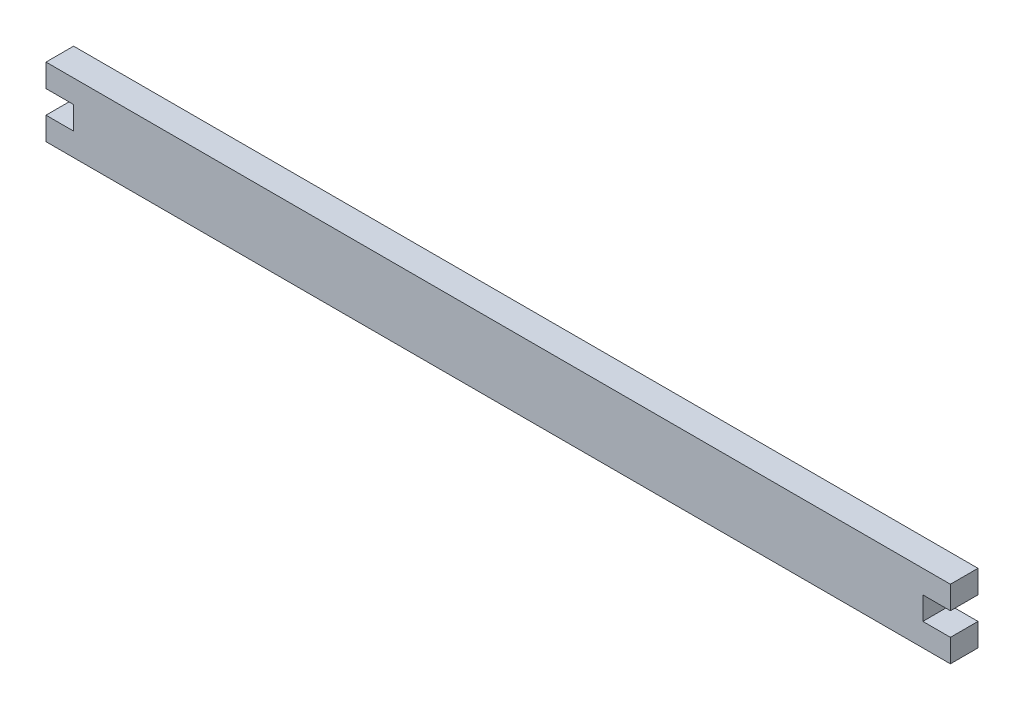
from build123d import *

# Parameters (mm, degrees)
SKETCH1_W             = 590
SKETCH1_H             = 45
EXTRUDE_360_DEPTH     = 18
CUT_EXTRUDE_575_REACH = 298.404
SKETCH2_W             = 18
SKETCH2_H             = 15


with BuildPart() as part:
    # Sketch1 → Extrude 360 (new body)
    with BuildSketch(Plane.XY):
        Rectangle(SKETCH1_W, SKETCH1_H)
    extrude(amount=EXTRUDE_360_DEPTH)

    # Sketch2 → Cut-Extrude 575 (cut, up to next)
    with BuildSketch(Plane.XY.offset(18), mode=Mode.PRIVATE) as cut_extrude_575_sk1:
        with Locations((-286, 0)):
            Rectangle(SKETCH2_W, SKETCH2_H)
    cut_extrude_575_tool1 = extrude(cut_extrude_575_sk1.sketch, amount=-CUT_EXTRUDE_575_REACH, mode=Mode.PRIVATE) & part.part
    cut_extrude_575 = cut_extrude_575_tool1.solids().sort_by_distance((-286, 0, 18))[0]
    add(cut_extrude_575, mode=Mode.SUBTRACT)

    # Mirror1: Cut-Extrude 575 across plane
    add(cut_extrude_575.mirror(Plane(origin=(0, 0, 0), x_dir=(0, 0, 1), z_dir=(1, 0, 0))), mode=Mode.SUBTRACT)


solid = part.part
